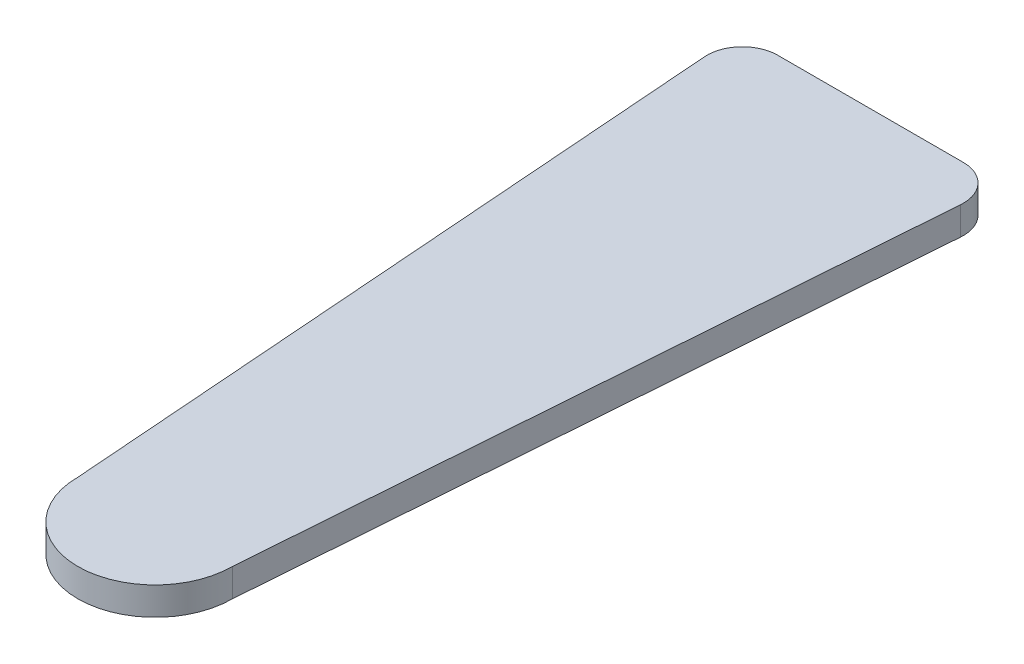
from build123d import *

# Parameters (mm, degrees)
BOSS_EXTRUDE1_DEPTH = 3.175
CUT_EXTRUDE1_DEPTH  = 221.006414679
FILLET2_R           = 8


with BuildPart() as part:
    # Sketch1 → Boss-Extrude1 (new, symmetric)
    with BuildSketch(Plane(origin=(0, 0, 0), x_dir=(1, 0, 0), z_dir=(0, 1, 0))):
        with BuildLine():
            ThreePointArc((32.5, 0), (0, 32.5), (-32.5, 0))
            Line((-32.5, 0), (-17.5, -200))
            ThreePointArc((-17.5, -200), (0, -217.5), (17.5, -200))
            Line((17.5, -200), (32.5, 0))
        make_face()
    extrude(amount=BOSS_EXTRUDE1_DEPTH, both=True)

    # Sketch2 → Cut-Extrude1 (cut, through all)
    with BuildSketch(Plane(origin=(0, 3.175, 0), x_dir=(1, 0, 0), z_dir=(0, 1, 0))):
        with BuildLine():
            Line((-29.65, -38), (29.65, -38))
            Line((29.65, -38), (32.5, 0))
            ThreePointArc((32.5, 0), (0, 32.5), (-32.5, 0))
            Line((-32.5, 0), (-29.65, -38))
        make_face()
    extrude(amount=-CUT_EXTRUDE1_DEPTH, mode=Mode.SUBTRACT)

    # Fillet2
    fillet2_edges = [part.edges().sort_by_distance(p)[0] for p in [
        (29.65, 0, 38),
        (-29.65, 0, 38),
    ]]
    fillet(fillet2_edges, radius=FILLET2_R)


solid = part.part
